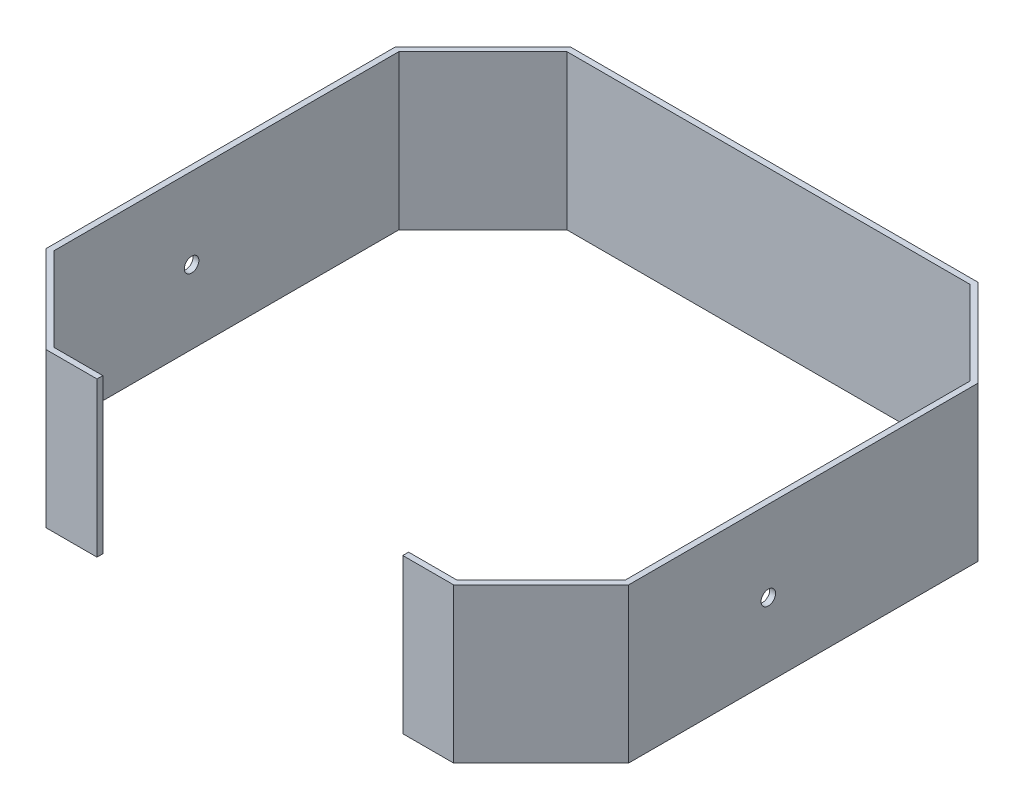
from build123d import *

# Parameters (mm, degrees)
ESBO_O1_W                = 200
ESBO_O1_H                = 180
RESSALTO_EXTRUS_O1_DEPTH = 26.5
CHANFRO1_SIZE            = 30
CASCA1_T                 = -2
ESBO_O2_W                = 105
ESBO_O2_H                = 53
CORTE_EXTRUS_O1_DEPTH    = 2
CAVIDADE1_START          = -100
CAVIDADE1_OUTLINE_R      = 2.5
CAVIDADE1_DEPTH          = 200


# Read off the part's stored shape, not the designer's step: Cavidade1
with BuildPart() as part:
    # Esboço1 → Ressalto-extrusão1 (new, symmetric)
    with BuildSketch(Plane(origin=(0, 0, 0), x_dir=(1, 0, 0), z_dir=(0, 1, 0))):
        Rectangle(ESBO_O1_W, ESBO_O1_H)
    extrude(amount=RESSALTO_EXTRUS_O1_DEPTH, both=True)

    # Chanfro1
    chanfro1_edges = [part.edges().sort_by_distance(p)[0] for p in [
        (100, 0, 90),
        (-100, 0, 90),
        (-100, 0, -90),
        (100, 0, -90),
    ]]
    chamfer(chanfro1_edges, length=CHANFRO1_SIZE)

    # Casca1
    casca1_openings = [part.faces().sort_by_distance(p)[0] for p in [
        (0, 26.5, 0),
        (0, -26.5, 0),
    ]]
    offset(amount=CASCA1_T, openings=casca1_openings, kind=Kind.INTERSECTION)

    # Esboço2 → Corte-extrusão1 (cut)
    with BuildSketch(Plane.XY.offset(90)):
        Rectangle(ESBO_O2_W, ESBO_O2_H)
    extrude(amount=-CORTE_EXTRUS_O1_DEPTH, mode=Mode.SUBTRACT)

    # Cavidade1 outline → Cavidade1 (cut)
    with BuildSketch(Plane.YZ.offset(CAVIDADE1_START)):
        with Locations((-1.25, 12)):
            Circle(CAVIDADE1_OUTLINE_R)
    extrude(amount=CAVIDADE1_DEPTH, mode=Mode.SUBTRACT)


solid = part.part
